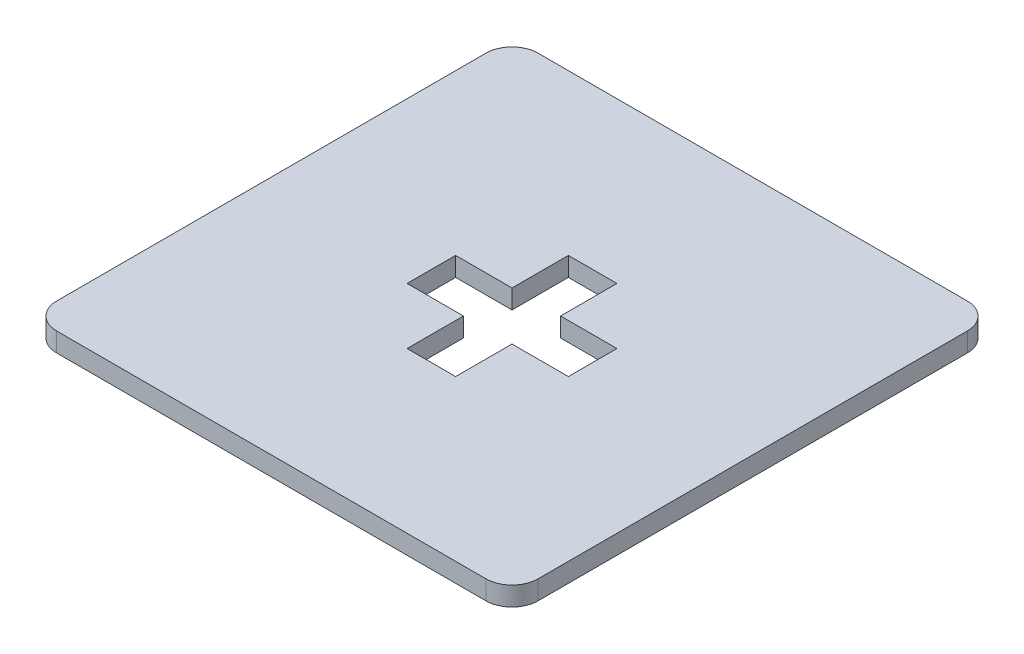
from build123d import *

# Parameters (mm, degrees)
ESBO_O1_W            = 55.5
ESBO_O1_H            = 55.5
BASE_DEPTH           = 2.2
ENCAIXE_DEPTH        = 40.306042792
FILETES_DOS_CANTOS_R = 3


with BuildPart() as part:
    # Esboço1 → Base (new body)
    with BuildSketch(Plane(origin=(0, 0, 0), x_dir=(1, 0, 0), z_dir=(0, 1, 0))):
        Rectangle(ESBO_O1_W, ESBO_O1_H)
    extrude(amount=BASE_DEPTH)

    # Esboço3 → Encaixe (cut, through all)
    with BuildSketch(Plane(origin=(0, 2.2, 0), x_dir=(1, 0, 0), z_dir=(0, 1, 0))):
        Polygon((2.8, 9.3), (-2.8, 9.3), (-2.8, 2.8), (-9.3, 2.8), (-9.3, -2.8), (-2.8, -2.8), (-2.8, -9.3), (2.8, -9.3), (2.8, -2.8), (9.3, -2.8), (9.3, 2.8), (2.8, 2.8), align=None)
    extrude(amount=-ENCAIXE_DEPTH, mode=Mode.SUBTRACT)

    # Filetes dos cantos
    filetes_dos_cantos_edges = [part.edges().sort_by_distance(p)[0] for p in [
        (27.75, 1.1, -27.75),
        (27.75, 1.1, 27.75),
        (-27.75, 1.1, -27.75),
        (-27.75, 1.1, 27.75),
    ]]
    fillet(filetes_dos_cantos_edges, radius=FILETES_DOS_CANTOS_R)


solid = part.part
